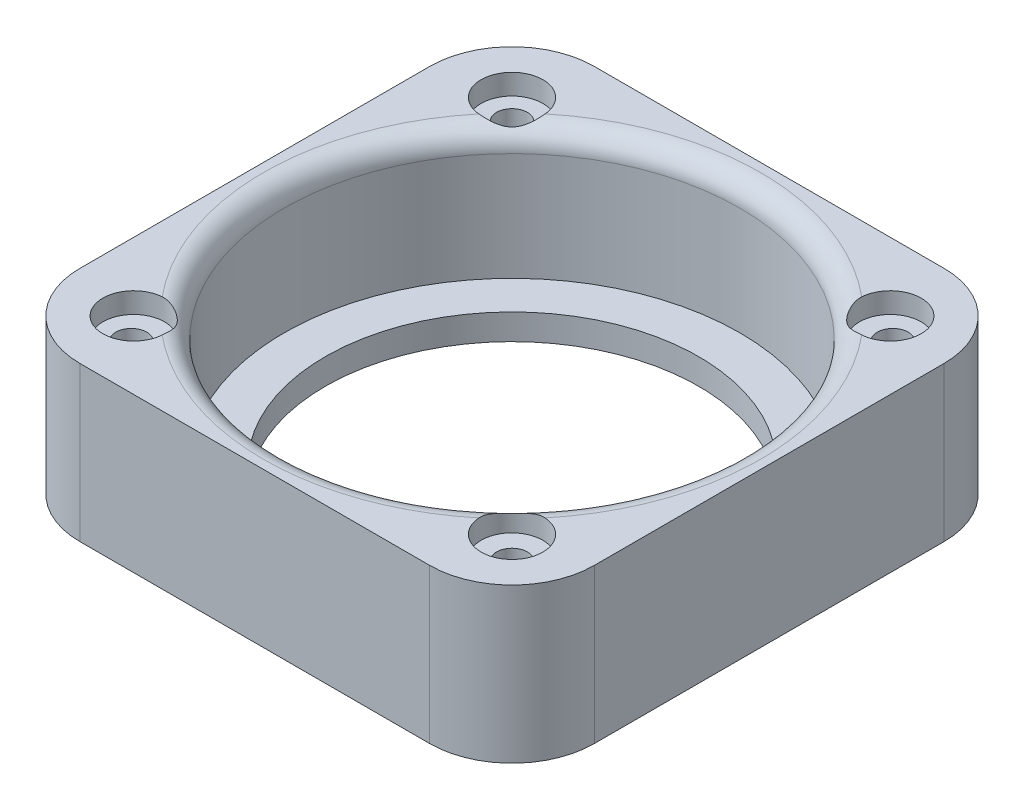
from build123d import *
from build123d.topology import SkipClean

# Parameters (mm, degrees)
SKETCH_1_R               = 25
EXTRUDE_1_DEPTH          = 15
SKETCH_2_R               = 22.15
CUT_EXTRUDE_1_DEPTH      = 12.5
SKETCH_3_R               = 18.15
CUT_EXTRUDE_2_DEPTH      = 12.5
EXTRUDE_2_DEPTH          = 15
FILLET_1_R               = 8
CUT_EXTRUDE_START        = -15
SKETCH_5_R               = 1.5
CUT_EXTRUDE_3_DEPTH      = 15
SKETCH_6_R               = 3
CUT_EXTRUDE_4_DEPTH      = 2
PATTERN_CIRCULAR_1_COUNT = 4
FILLET_2_R               = 2


with BuildPart() as part:
    # 草图1 → 凸台-拉伸1 (new body)
    with BuildSketch(Plane(origin=(0, 0, 0), x_dir=(1, 0, 0), z_dir=(0, 1, 0))):
        with Locations(Location((0, 0, 0), (0, 0, 270))):
            Circle(SKETCH_1_R)
    extrude(amount=EXTRUDE_1_DEPTH)

    # 草图2 → 切除-拉伸1 (cut)
    with BuildSketch(Plane(origin=(0, 15, 0), x_dir=(1, 0, 0), z_dir=(0, 1, 0))):
        with Locations(Location((0, 0, 0), (0, 0, 270))):
            Circle(SKETCH_2_R)
    extrude(amount=-CUT_EXTRUDE_1_DEPTH, mode=Mode.SUBTRACT)

    # 草图3 → 切除-拉伸2 (cut)
    with BuildSketch(Plane(origin=(0, 2.5, 0), x_dir=(1, 0, 0), z_dir=(0, 1, 0))):
        with Locations(Location((0, 0, 0), (0, 0, 270))):
            Circle(SKETCH_3_R)
    extrude(amount=-CUT_EXTRUDE_2_DEPTH, mode=Mode.SUBTRACT)

    # 草图4 → 凸台-拉伸2 (add)
    with BuildSketch(Plane(origin=(0, 0, 0), x_dir=(1, 0, 0), z_dir=(0, 1, 0))):
        with BuildLine():
            Line((0, 25), (-25, 25))
            Line((-25, 25), (-25, 2.6e-08))
            ThreePointArc((-25, 2.6e-08), (-23.301207713, 9.058350794), (-18.435702489, 16.885641052))
            ThreePointArc((-18.435702489, 16.885641052), (-19.445436483, 19.445436483), (-16.885641052, 18.435702489))
            ThreePointArc((-16.885641052, 18.435702489), (-9.058350782, 23.301207718), (0, 25))
        make_face()
        with BuildLine():
            Line((25, 25), (0, 25))
            ThreePointArc((0, 25), (9.210354363, 23.241544108), (17.125028574, 18.213549801))
            ThreePointArc((17.125028574, 18.213549801), (19.682469279, 19.438809921), (18.425448396, 16.896829626))
            ThreePointArc((18.425448396, 16.896829626), (23.298457137, 9.065423048), (25, 0))
            Line((25, 0), (25, 25))
        make_face()
        with BuildLine():
            ThreePointArc((-18.213549801, -17.125028574), (-23.241544113, -9.210354351), (-25, 2.6e-08))
            Line((-25, 2.6e-08), (-25, -25))
            Line((-25, -25), (-5.8e-08, -25))
            ThreePointArc((-5.8e-08, -25), (-9.065423076, -23.298457126), (-16.896829626, -18.425448396))
            ThreePointArc((-16.896829626, -18.425448396), (-19.438809921, -19.682469279), (-18.213549801, -17.125028574))
        make_face()
        with BuildLine():
            Line((25, -25), (25, 0))
            ThreePointArc((25, 0), (23.22561674, -9.250444694), (18.154341838, -17.18778265))
            ThreePointArc((18.154341838, -17.18778265), (19.675883861, -19.675883861), (17.18778265, -18.154341838))
            ThreePointArc((17.18778265, -18.154341838), (9.250444666, -23.225616751), (-5.8e-08, -25))
            Line((-5.8e-08, -25), (25, -25))
        make_face()
    extrude(amount=EXTRUDE_2_DEPTH)

    # 圆角1
    fillet_1_edges = [part.edges().sort_by_distance(p)[0] for p in [
        (-25, 7.5, -25),
        (25, 7.5, -25),
        (-25, 7.5, 25),
        (25, 7.5, 25),
    ]]
    fillet(fillet_1_edges, radius=FILLET_1_R)

    # 草图5 → 切除-拉伸3 (cut)
    with BuildSketch(Plane(origin=(0, 15, 0), x_dir=(1, 0, 0), z_dir=(0, 1, 0)).offset(CUT_EXTRUDE_START)):
        with Locations(Location((-18.384776311, 18.384776311, 0), (0, 0, 270))):
            Circle(SKETCH_5_R)
        with Locations(Location((18.615223689, 18.384776311, 0), (0, 0, 270))):
            Circle(SKETCH_5_R)
        with Locations(Location((18.615223689, -18.615223689, 0), (0, 0, 270))):
            Circle(SKETCH_5_R)
        with Locations(Location((-18.384776311, -18.615223689, 0), (0, 0, 270))):
            Circle(SKETCH_5_R)
    extrude(amount=CUT_EXTRUDE_3_DEPTH, mode=Mode.SUBTRACT)

    # 草图6 → 切除-拉伸4 (cut)
    with BuildSketch(Plane(origin=(0, 15, 0), x_dir=(1, 0, 0), z_dir=(0, 1, 0))):
        with Locations(Location((-18.384776311, 18.384776311, 0), (0, 0, 270))):
            Circle(SKETCH_6_R)
    cut_extrude_4 = extrude(amount=-CUT_EXTRUDE_4_DEPTH, mode=Mode.SUBTRACT)

    # 阵列(圆周)1: 切除-拉伸4 ×4 about axis
    with SkipClean():  # the faces are left unmerged after this step: merging them gives an invalid solid
        pattern_circular_1_axis = Axis((0, 0, 0), (0, 1, 0))
        for i in range(1, PATTERN_CIRCULAR_1_COUNT):
            add(cut_extrude_4.rotate(pattern_circular_1_axis, i * 360 / PATTERN_CIRCULAR_1_COUNT), mode=Mode.SUBTRACT)

    # 圆角2
    # the kernel refuses this fillet: 2 mm, written as the material it takes off along each edge
    with BuildSketch(Plane(origin=(0, 15, 0), x_dir=(0, 0, 1), z_dir=(-1, 0, 0))) as fillet_2_piece_1:
        with BuildLine():
            CenterArc((22.15 + FILLET_2_R, -FILLET_2_R), FILLET_2_R, 90, 90)
            Line((22.15, -FILLET_2_R), (22.15, 0))
            Line((22.15, 0), (22.15 + FILLET_2_R, 0))
        make_face()
    revolve(axis=Axis((0, 15, 0), (0, 1, 0)), mode=Mode.SUBTRACT)


solid = part.part
